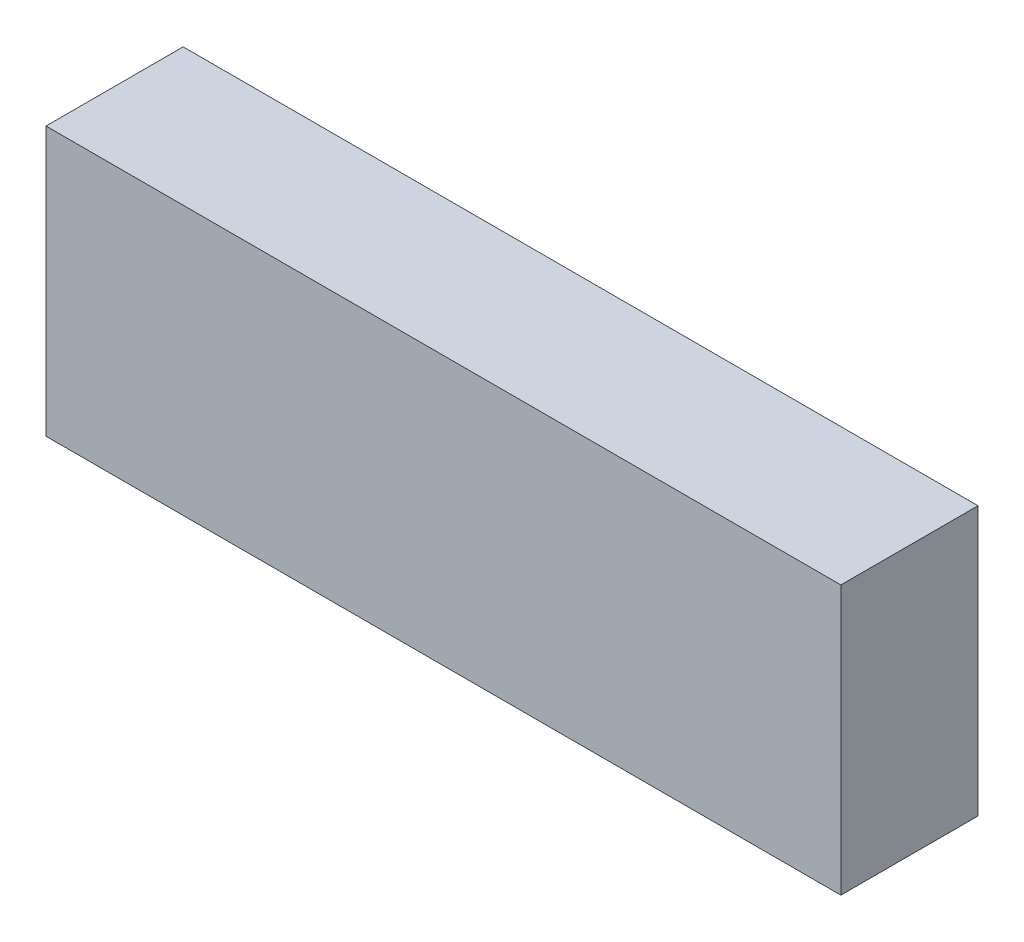
from build123d import *

# Parameters (mm, degrees)
SKETCH1_W           = 142
SKETCH1_H           = 48
BOSS_EXTRUDE1_DEPTH = 24.5


with BuildPart() as part:
    # Sketch1 → Boss-Extrude1 (new body)
    with BuildSketch(Plane.XY):
        with Locations((71, 24)):
            Rectangle(SKETCH1_W, SKETCH1_H)
    extrude(amount=BOSS_EXTRUDE1_DEPTH)


solid = part.part
